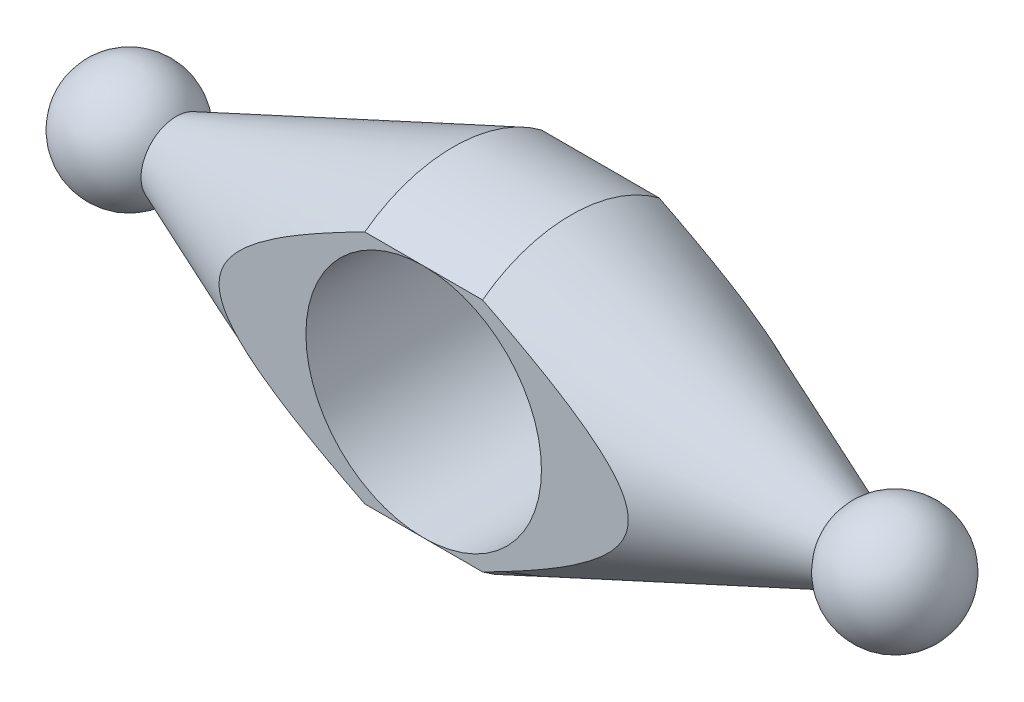
from build123d import *


with BuildPart() as part:
    # Эскиз1 → Повернуть1 (revolve)
    with BuildSketch(Plane.XY):
        with BuildLine():
            Line((9, 3), (32.5, 12.5))
            Line((32.5, 12.5), (42.5, 12.5))
            Line((42.5, 12.5), (66, 3))
            ThreePointArc((66, 3), (71.58113883, 4.74341649), (75, 0))
            Line((75, 0), (0, 0))
            ThreePointArc((0, 0), (3.41886117, 4.74341649), (9, 3))
        make_face()
    revolve(axis=Axis((0, 0, 0), (1, 0, 0)))

    # Эскиз4 → Вырез-Повернуть1 (revolve, cut)
    with BuildSketch(Plane(origin=(37.5, 0, 0), x_dir=(0, 0, -1), z_dir=(1, 0, 0))):
        Polygon((-7.5, 10), (7.5, 10), (7.5, 20), (15, 20), (15, 0), (-15, 0), (-15, 20), (-7.5, 20), align=None)
    revolve(axis=Axis((37.5, 0, 0), (0, 0, -1)), mode=Mode.SUBTRACT)


solid = part.part
